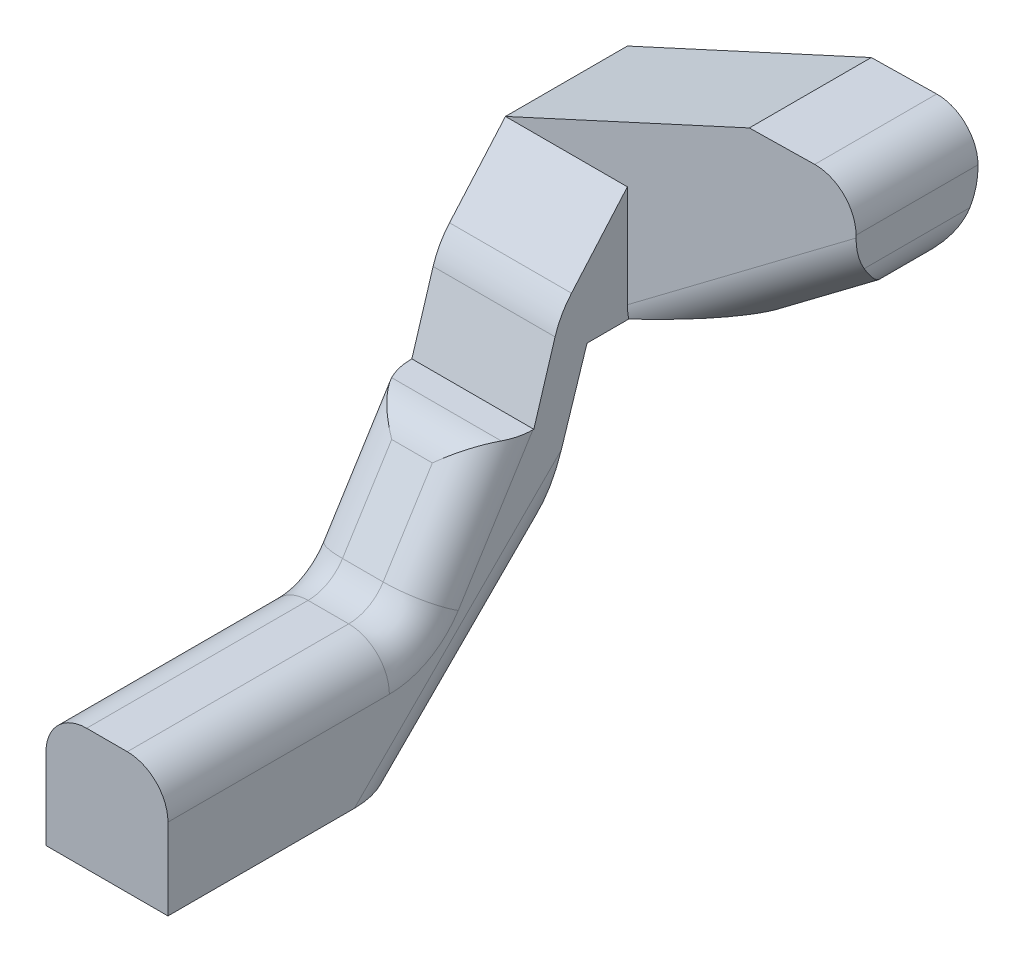
from build123d import *

# Parameters (mm, degrees)
SKETCH1_W           = 15
SKETCH1_H           = 15
BOSS_EXTRUDE1_DEPTH = 30
BOSS_EXTRUDE2_DEPTH = 15
BOSS_EXTRUDE3_DEPTH = 15
FILLET1_R           = 5
FILLET2_R           = 5
FILLET3_R           = 5
FILLET4_R           = 5
FILLET5_R           = 10


with BuildPart() as part:
    # Sketch1 → Boss-Extrude1 (new body)
    with BuildSketch(Plane.XY):
        Rectangle(SKETCH1_W, SKETCH1_H)
    extrude(amount=BOSS_EXTRUDE1_DEPTH)

    # Sketch2 → Boss-Extrude2 (add)
    with BuildSketch(Plane(origin=(7.5, 0, 0), x_dir=(0, 0, -1), z_dir=(1, 0, 0))):
        Polygon((0, 7.5), (0, -7.5), (15, 7.5), (21.545785732, 27.742247112), (26.510349476, 27.742247112), (26.510349476, 32.414777695), (26.510349476, 41.912857566), (18.236076569, 32.414777695), (15, 21.844799658), (8.988359791, 21.844799658), align=None)
    extrude(amount=-BOSS_EXTRUDE2_DEPTH)

    # Sketch3 → Boss-Extrude3 (add)
    with BuildSketch(Plane(origin=(0, 0, -26.510349476), x_dir=(-1, 0, 0), z_dir=(0, 0, -1))):
        Polygon((-7.5, 27.742247112), (-22.495127837, 34.382116855), (-35.622841112, 44.261996271), (-35.622841112, 55.90842978), (-22.495127837, 55.685698079), (7.5, 41.912857566), (7.5, 27.742247112), align=None)
    extrude(amount=BOSS_EXTRUDE3_DEPTH)

    # Fillet1
    fillet1_edges = [part.edges().sort_by_distance(p)[0] for p in [
        (35.622841112, 55.90842978, -34.010349476),
    ]]
    fillet(fillet1_edges, radius=FILLET1_R)

    # Fillet2
    # the kernel refuses this fillet: 5 mm, written as the material it takes off along each edge
    with BuildSketch(Plane(origin=(-7.467478677, 11.832344997, -41.510349476), x_dir=(0, 0, 1), z_dir=(0.7990028403879673, 0.6013272495504927, 0))) as fillet2_piece_1:
        with BuildLine():
            CenterArc((FILLET2_R, -FILLET2_R), FILLET2_R, 90, 90)
            Line((0, -FILLET2_R), (0, 0))
            Line((0, 0), (FILLET2_R, 0))
        make_face()
    extrude(amount=66.430120909, mode=Mode.SUBTRACT)
    with BuildSketch(Plane(origin=(22.495127837, 34.382116855, -25.077185007), x_dir=(0.7990028403879682, 0.6013272495504913, 0), z_dir=(0, 0, -1))) as fillet2_piece_2:
        with BuildLine():
            CenterArc((FILLET2_R * 0.11465315755, -FILLET2_R), FILLET2_R, 90, 13.081164811)
            Line((-FILLET2_R * 0.111677956622, -FILLET2_R * 0.0259495768916), (0, 0))
            Line((0, 0), (FILLET2_R * 0.11465315755, 0))
        make_face()
    extrude(amount=17.866328939, mode=Mode.SUBTRACT)
    with BuildSketch(Plane(origin=(-7.467478677, 11.832344997, -26.510349476), x_dir=(-0.6013272495504927, 0.7990028403879673, 0), z_dir=(0.7990028403879673, 0.6013272495504927, 0))) as fillet2_piece_3_section:
        with BuildLine():
            CenterArc((FILLET2_R, -FILLET2_R), FILLET2_R, 90, 90)
            Line((0, -FILLET2_R), (0, 0))
            Line((0, 0), (FILLET2_R, 0))
        make_face()
    fillet2_piece_3 = extrude(amount=66.430120909, mode=Mode.PRIVATE)
    fillet2_piece_3 = split(fillet2_piece_3, bisect_by=Plane(origin=(7.5, 11.832344997, -26.510349476), z_dir=(1, 0, 0)), keep=Keep.TOP, mode=Mode.PRIVATE)
    add(fillet2_piece_3, mode=Mode.SUBTRACT)
    with BuildSketch(Plane(origin=(35.622841112, 44.261996271, -20.2733136), x_dir=(0, 1, 0), z_dir=(0, 0, -1))) as fillet2_piece_4:
        with BuildLine():
            CenterArc((FILLET2_R * 0.498962870089, -FILLET2_R), FILLET2_R, 90, 53.03498585)
            Line((-FILLET2_R * 0.300039970299, -FILLET2_R * 0.39867275045), (0, 0))
            Line((0, 0), (FILLET2_R * 0.498962870089, 0))
        make_face()
    extrude(amount=27.474071752, mode=Mode.SUBTRACT)

    # Fillet3
    fillet3_edges = [part.edges().sort_by_distance(p)[0] for p in [
        (0, 7.5, -15),
        (7.5, 0, -7.5),
        (-7.5, 0, -7.5),
        (0, -7.5, 0),
    ]]
    fillet(fillet3_edges, radius=FILLET3_R)

    # Fillet4
    fillet4_edges = [part.edges().sort_by_distance(p)[0] for p in [
        (0, 21.844799658, -8.988359791),
        (7.5, 14.672399829, -4.494179896),
        (-7.5, 14.672399829, -4.494179896),
        (0, 7.5, 0),
        (-7.5, 7.5, 15),
        (7.5, 7.5, 15),
    ]]
    fillet(fillet4_edges, radius=FILLET4_R)

    # Fillet5
    fillet5_edges = [part.edges().sort_by_distance(p)[0] for p in [
        (0, 32.414777695, -18.236076569),
    ]]
    fillet(fillet5_edges, radius=FILLET5_R)


solid = part.part
